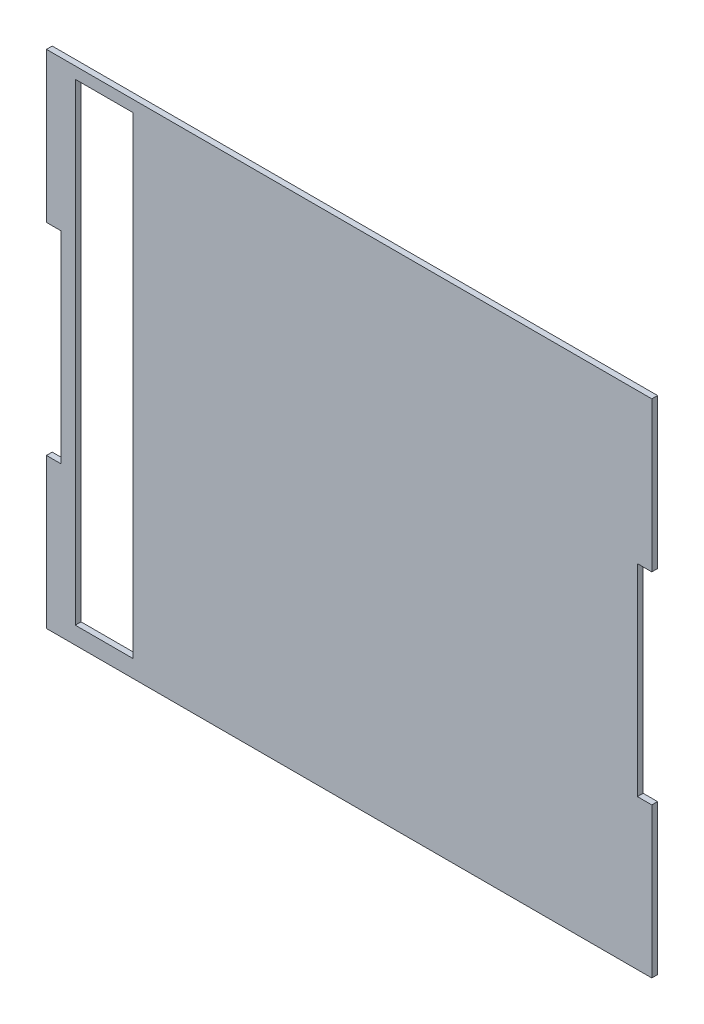
from build123d import *

# Parameters (mm, degrees)
EXTRUDE_1_DEPTH = 2


with BuildPart() as part:
    # 草图1 → 凸台-拉伸1 (new body)
    with BuildSketch(Plane.XY):
        Polygon((104.5, 35), (104.5, 87), (-105.5, 87), (-105.5, 35), (-100.5, 35), (-100.5, -35), (-105.5, -35), (-105.5, -87), (104.5, -87), (104.5, -35), (99.5, -35), (99.5, 35), align=None)
        Polygon((-95.5, 35), (-95.5, 83), (-75.5, 83), (-75.5, -81), (-95.5, -81), align=None, mode=Mode.SUBTRACT)
    extrude(amount=EXTRUDE_1_DEPTH)


solid = part.part
